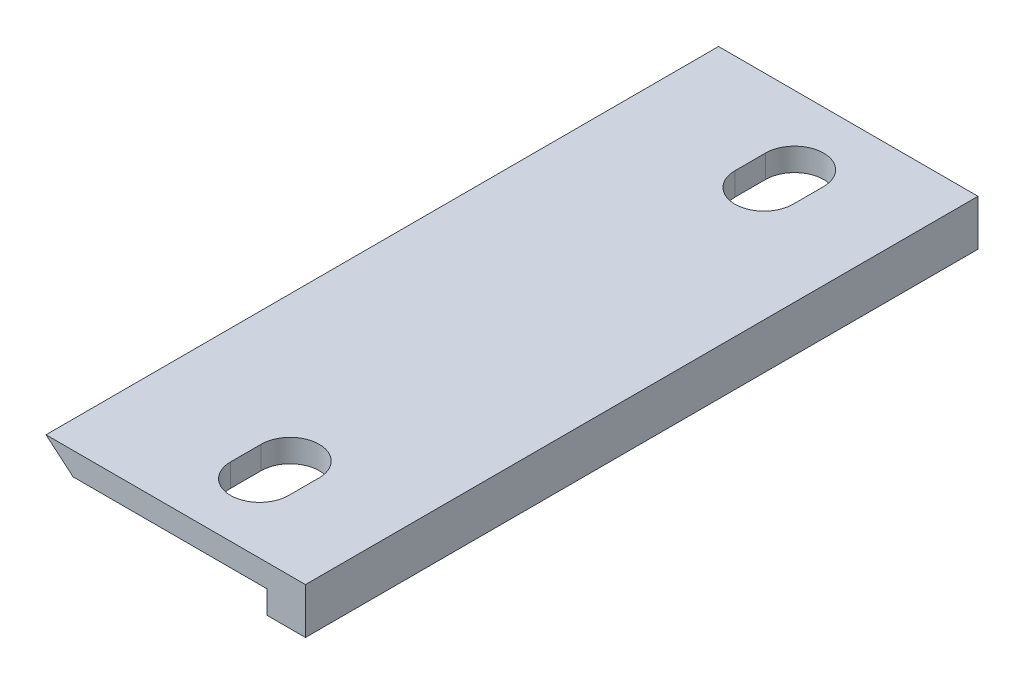
from build123d import *

# Parameters (mm, degrees)
EXTRUDE_1_DEPTH     = 440
CUT_EXTRUDE_1_DEPTH = 473.561598908


with BuildPart() as part:
    # Эскиз1 → Бобышка-Вытянуть1 (new body)
    with BuildSketch(Plane.XY):
        Polygon((169.748239349, 0), (0, 0), (17.748239349, -15), (144.748239349, -15), (144.748239349, -30), (169.748239349, -30), align=None)
    extrude(amount=-EXTRUDE_1_DEPTH)

    # Эскиз4 → Вырез-Вытянуть1 (cut, through all)
    with BuildSketch(Plane(origin=(0, 0, 0), x_dir=(1, 0, 0), z_dir=(0, 1, 0))):
        with BuildLine():
            Line((75.748239349, 65), (75.748239349, 45))
            ThreePointArc((75.748239349, 45), (94.748239349, 26), (113.748239349, 45))
            Line((113.748239349, 45), (113.748239349, 65))
            ThreePointArc((113.748239349, 65), (94.748239349, 84), (75.748239349, 65))
        make_face()
        with BuildLine():
            Line((75.748239349, 395), (75.748239349, 375))
            ThreePointArc((75.748239349, 375), (94.748239349, 356), (113.748239349, 375))
            Line((113.748239349, 375), (113.748239349, 395))
            ThreePointArc((113.748239349, 395), (94.748239349, 414), (75.748239349, 395))
        make_face()
    extrude(amount=-CUT_EXTRUDE_1_DEPTH, mode=Mode.SUBTRACT)


solid = part.part
